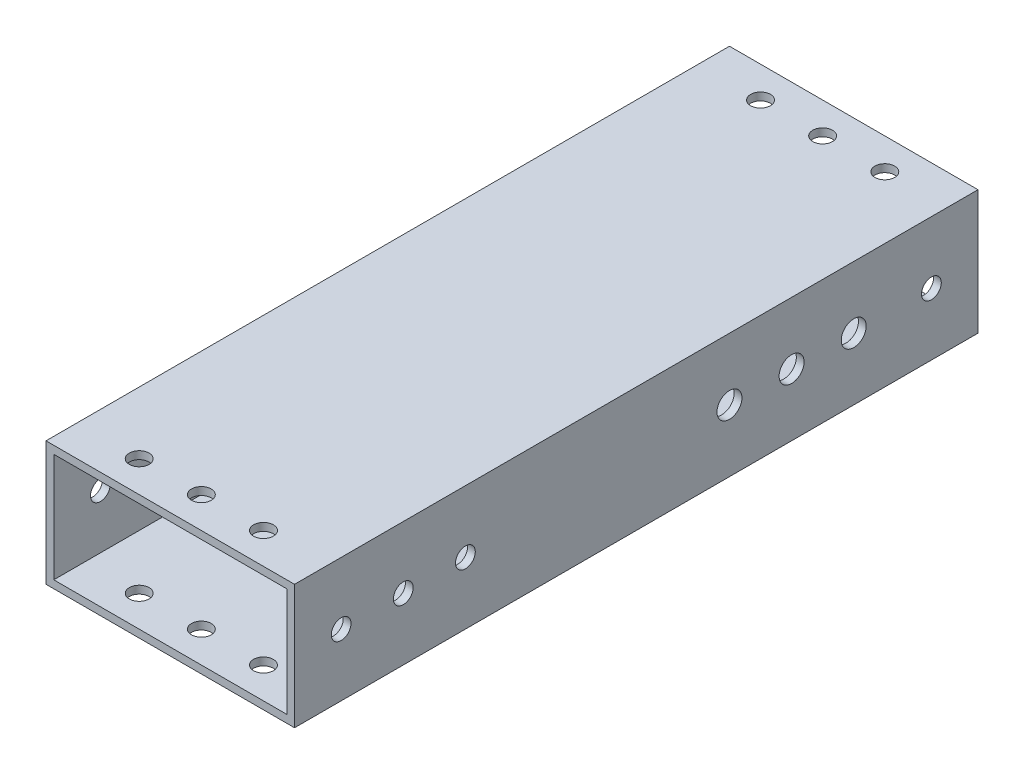
from build123d import *

# Parameters (mm, degrees)
SKETCH1_W           = 50.8
SKETCH1_H           = 25.4
SKETCH1_W_2         = 47.625
SKETCH1_H_2         = 22.225
BOSS_EXTRUDE1_DEPTH = 69.85
SKETCH2_R           = 2.0193
CUT_EXTRUDE1_DEPTH  = 79.545162168
SKETCH3_R           = 2.0193
CUT_EXTRUDE2_DEPTH  = 88.298066989
SKETCH5_R           = 2.5527
CUT_EXTRUDE3_DEPTH  = 88.298066989


with BuildPart() as part:
    # Sketch1 → Boss-Extrude1 (new, symmetric)
    with BuildSketch(Plane.XY):
        Rectangle(SKETCH1_W, SKETCH1_H)
        Rectangle(SKETCH1_W_2, SKETCH1_H_2, mode=Mode.SUBTRACT)
    extrude(amount=BOSS_EXTRUDE1_DEPTH, both=True)

    # Sketch2 → Cut-Extrude1 (cut, through all)
    with BuildSketch(Plane(origin=(0, 12.7, 0), x_dir=(1, 0, 0), z_dir=(0, 1, 0))):
        with Locations((-12.7, 63.5)):
            Circle(SKETCH2_R)
        with Locations((0, 63.5)):
            Circle(SKETCH2_R)
        with Locations((12.7, 63.5)):
            Circle(SKETCH2_R)
        with Locations((12.7, -63.5)):
            Circle(SKETCH2_R)
        with Locations((0, -63.5)):
            Circle(SKETCH2_R)
        with Locations((-12.7, -63.5)):
            Circle(SKETCH2_R)
    extrude(amount=-CUT_EXTRUDE1_DEPTH, mode=Mode.SUBTRACT)

    # Sketch3 → Cut-Extrude2 (cut, through all)
    with BuildSketch(Plane.ZY.offset(25.4)):
        with Locations((-60.325, 0)):
            Circle(SKETCH3_R)
        with Locations((60.325, 0)):
            Circle(SKETCH3_R)
        with Locations((34.925, 0)):
            Circle(SKETCH3_R)
        with Locations((47.625, 0)):
            Circle(SKETCH3_R)
    extrude(amount=-CUT_EXTRUDE2_DEPTH, mode=Mode.SUBTRACT)

    # Sketch5 → Cut-Extrude3 (cut, through all)
    with BuildSketch(Plane(origin=(25.4, 0, 0), x_dir=(0, 0, -1), z_dir=(1, 0, 0))):
        with Locations((31.75, 0)):
            Circle(SKETCH5_R)
        with Locations((44.45, 0)):
            Circle(SKETCH5_R)
        with Locations((19.05, 0)):
            Circle(SKETCH5_R)
    extrude(amount=-CUT_EXTRUDE3_DEPTH, mode=Mode.SUBTRACT)


solid = part.part
